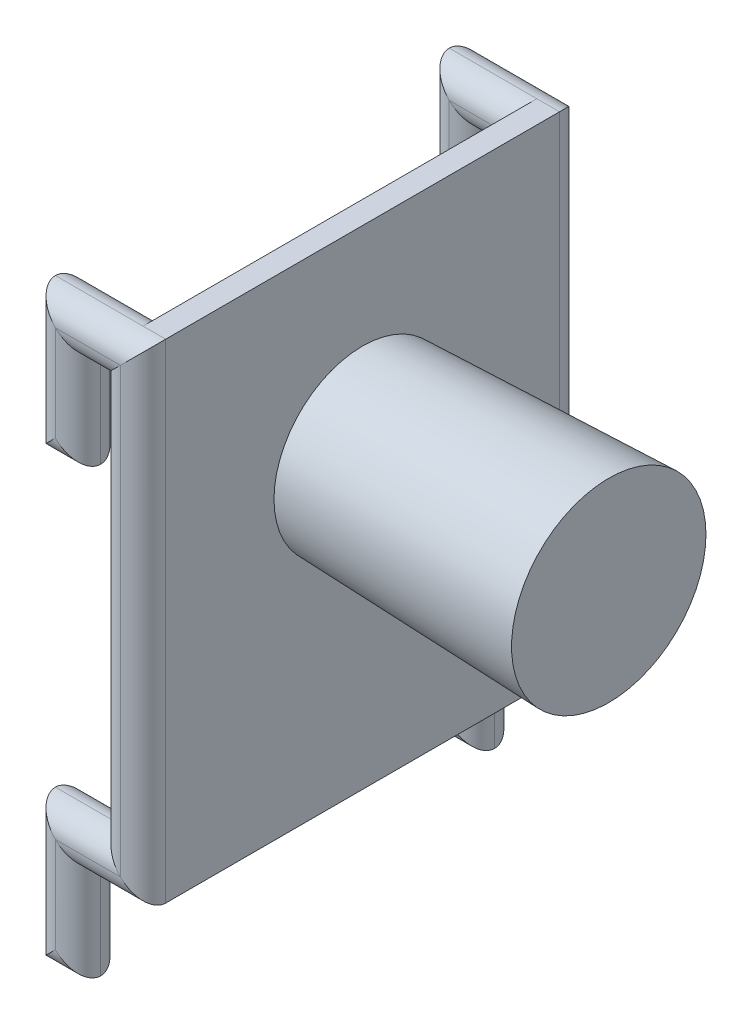
from build123d import *

# Parameters (mm, degrees)
EXTRU_MINCE1_DEPTH         = 2.3
CONG_1_R                   = 2.3
ESQUISSE2_W                = 40
ESQUISSE2_H                = 49.6
BOSS_EXTRU_1_DEPTH         = 2.3
R_P_TITION_LIN_AIRE1_COUNT = 2
R_P_TITION_LIN_AIRE1_PITCH = 40
CONG_2_R                   = 2.3
ESQUISSE3_R                = 9
BOSS_EXTRU_2_DEPTH         = 25
BOSS_EXTRU_2_DRAFT         = -2


with BuildPart() as part:
    # Esquisse1 → Extru.-Mince1 (new, symmetric)
    with BuildSketch(Plane.XY):
        Polygon((-4.3, -57), (-4.3, -47.3), (2.3, -47.3), (2.3, 2.3), (-8.9, 2.3), (-8.9, -12), (-4.3, -12), (-4.3, -2.3), (-2.3, -2.3), (-2.3, -42.7), (-8.9, -42.7), (-8.9, -57), align=None)
    extru_mince1 = extrude(amount=EXTRU_MINCE1_DEPTH, both=True)

    # Congé1
    cong_1_edges = [part.edges().sort_by_distance(p)[0] for p in [
        (-6.6, -57, -2.3),
        (-4.3, -52.15, -2.3),
        (-1, -47.3, -2.3),
        (2.3, -22.5, -2.3),
        (-3.3, 2.3, -2.3),
        (-8.9, -4.85, -2.3),
        (-6.6, -12, -2.3),
        (-4.3, -7.15, -2.3),
        (-3.3, -2.3, -2.3),
        (-2.3, -22.5, -2.3),
        (-5.6, -42.7, -2.3),
        (-8.9, -49.85, -2.3),
        (-5.6, -42.7, 2.3),
        (-2.3, -22.5, 2.3),
        (-3.3, -2.3, 2.3),
        (-4.3, -7.15, 2.3),
        (-6.6, -12, 2.3),
        (-8.9, -4.85, 2.3),
        (-3.3, 2.3, 2.3),
        (2.3, -22.5, 2.3),
        (-1, -47.3, 2.3),
        (-4.3, -52.15, 2.3),
        (-6.6, -57, 2.3),
        (-8.9, -49.85, 2.3),
    ]]
    fillet(cong_1_edges, radius=CONG_1_R - 0.0001)  # a hair under: the kernel refuses the full size

    # Esquisse2 → Boss.-Extru.1 (add)
    with BuildSketch(Plane(origin=(0, 0, 0), x_dir=(0, 0, -1), z_dir=(1, 0, 0))):
        with Locations((-20, -22.5)):
            Rectangle(ESQUISSE2_W, ESQUISSE2_H)
    extrude(amount=BOSS_EXTRU_1_DEPTH)

    # Répétition linéaire1: Extru.-Mince1 ×2
    with Locations(*[(0, 0, i * R_P_TITION_LIN_AIRE1_PITCH) for i in range(1, R_P_TITION_LIN_AIRE1_COUNT)]):
        add(extru_mince1)

    # Congé2
    cong_2_edges = [part.edges().sort_by_distance(p)[0] for p in [
        (-5.6, -42.7, 42.3),
        (-2.3, -22.5, 42.3),
        (-3.3, -2.3, 42.3),
        (-4.3, -7.15, 42.3),
        (-6.6, -12, 42.3),
        (-8.9, -4.85, 42.3),
        (-3.3, 2.3, 42.3),
        (2.3, -22.5, 42.3),
        (-1, -47.3, 42.3),
        (-4.3, -52.15, 42.3),
        (-6.6, -57, 42.3),
        (-8.9, -49.85, 42.3),
        (-2.15, -47.3, 37.7),
        (-4.3, -52.15, 37.7),
        (-6.6, -57, 37.7),
        (-8.9, -49.85, 37.7),
        (-5.6, -42.7, 37.7),
        (-2.3, -22.5, 37.7),
        (-3.3, -2.3, 37.7),
        (-4.3, -7.15, 37.7),
        (-6.6, -12, 37.7),
        (-8.9, -4.85, 37.7),
        (-4.45, 2.3, 37.7),
    ]]
    fillet(cong_2_edges, radius=CONG_2_R - 0.0001)  # a hair under: the kernel refuses the full size


with BuildPart() as boss_extru_2_tool:
    # Esquisse3 → Boss.-Extru.2 (with draft: the straight prism first)
    with BuildSketch(Plane(origin=(2.3, 0, 0), x_dir=(0, 0, -1), z_dir=(1, 0, 0))):
        with Locations((-20, -17.3)):
            Circle(ESQUISSE3_R)
    extrude(amount=BOSS_EXTRU_2_DEPTH)
    # Boss.-Extru.2: the draft: its side faces are tilted about the plane it starts from
    boss_extru_2_sides = [boss_extru_2_tool.faces().sort_by_distance(p)[0] for p in [
        (14.8, -17.3, 29),
    ]]
    draft(boss_extru_2_sides, Plane(origin=(2.3, 0, 0), x_dir=(0, 0, -1), z_dir=(1, 0, 0)), BOSS_EXTRU_2_DRAFT)


with BuildPart() as part_1:
    add(part.part)

    # Boss.-Extru.2: add boss_extru_2_tool
    add(boss_extru_2_tool.part)


solid = part_1.part
